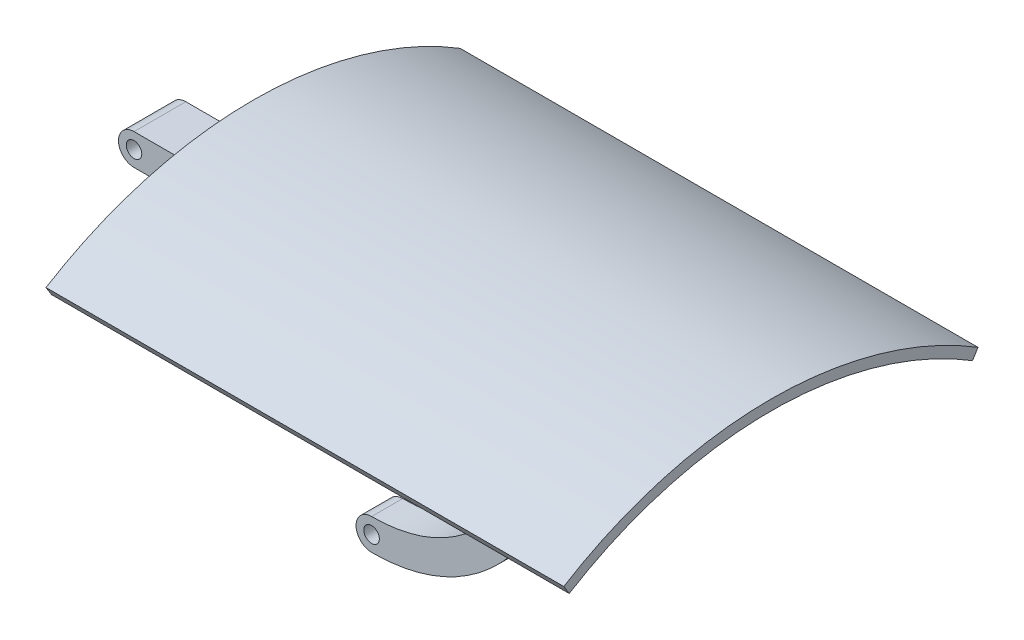
from build123d import *

# Parameters (mm, degrees)
BOSS_EXTRU_1_DEPTH      = 100
BOSS_EXTRU_2_DEPTH      = 3
BOSS_EXTRU_2_DEPTH_BACK = 3
ESQUISSE3_R             = 1.5
BOSS_EXTRU_3_DEPTH      = 5
BOSS_EXTRU_3_DEPTH_BACK = 5
ESQUISSE7_R             = 1.5


with BuildPart() as part:
    # Esquisse1 → Boss.-Extru.1 (new body)
    with BuildSketch(Plane(origin=(0, 0, 0), x_dir=(0, 0, -1), z_dir=(1, 0, 0))):
        with BuildLine():
            Line((-40, 64.857073631), (-38.950131234, 63.154788234))
            ThreePointArc((-38.950131234, 63.154788234), (0, 74.2), (38.950131234, 63.154788234))
            Line((38.950131234, 63.154788234), (40, 64.857073631))
            ThreePointArc((40, 64.857073631), (0, 76.2), (-40, 64.857073631))
        make_face()
    extrude(amount=BOSS_EXTRU_1_DEPTH)

    # Esquisse3 → Boss.-Extru.2 (add, two sides: drawn at the far end of the back side and taken through both)
    with BuildSketch(Plane.XY.offset(-BOSS_EXTRU_2_DEPTH_BACK)):
        with BuildLine():
            Line((60, 74.2), (60, 69.2))
            add(Edge.make_bspline(
                [(60, 69.2), (60, 40.509965436), (46.638630349, 21), (25.878079111, 21)],
                knots=[0, 0, 0, 0, 1, 1, 1, 1], degree=3))
            ThreePointArc((25.878079111, 21), (22.878079111, 18.000000825), (25.87807746, 15))
            add(Edge.make_bspline(
                [(66, 69.2), (66, 41.462032262), (51.753349645, 15), (25.87807746, 15)],
                knots=[0, 0, 0, 0, 1, 1, 1, 1], degree=3))
            Line((66, 69.2), (66, 74.2))
            Line((66, 74.2), (60, 74.2))
        make_face()
        with Locations((25.878079111, 18)):
            Circle(ESQUISSE3_R, mode=Mode.SUBTRACT)
    extrude(amount=BOSS_EXTRU_2_DEPTH + BOSS_EXTRU_2_DEPTH_BACK)

    # Esquisse7 → Boss.-Extru.3 (add, two sides: drawn at the far end of the back side and taken through both)
    with BuildSketch(Plane.XY.offset(-BOSS_EXTRU_3_DEPTH_BACK)):
        with BuildLine():
            Line((7, 74.2), (7, 73.544291939))
            Line((7, 73.544291939), (-6.331051255, 64.43935692))
            Line((-6.331051255, 64.43935692), (-18, 64.43935692))
            ThreePointArc((-18, 64.43935692), (-21, 61.43935692), (-18, 58.43935692))
            Line((-18, 58.43935692), (-4.539014482, 58.43935692))
            Line((-4.539014482, 58.43935692), (13, 70.418276219))
            Line((13, 70.418276219), (13, 74.2))
            Line((13, 74.2), (7, 74.2))
        make_face()
        with Locations((-18, 61.43935692)):
            Circle(ESQUISSE7_R, mode=Mode.SUBTRACT)
    extrude(amount=BOSS_EXTRU_3_DEPTH + BOSS_EXTRU_3_DEPTH_BACK)


solid = part.part
